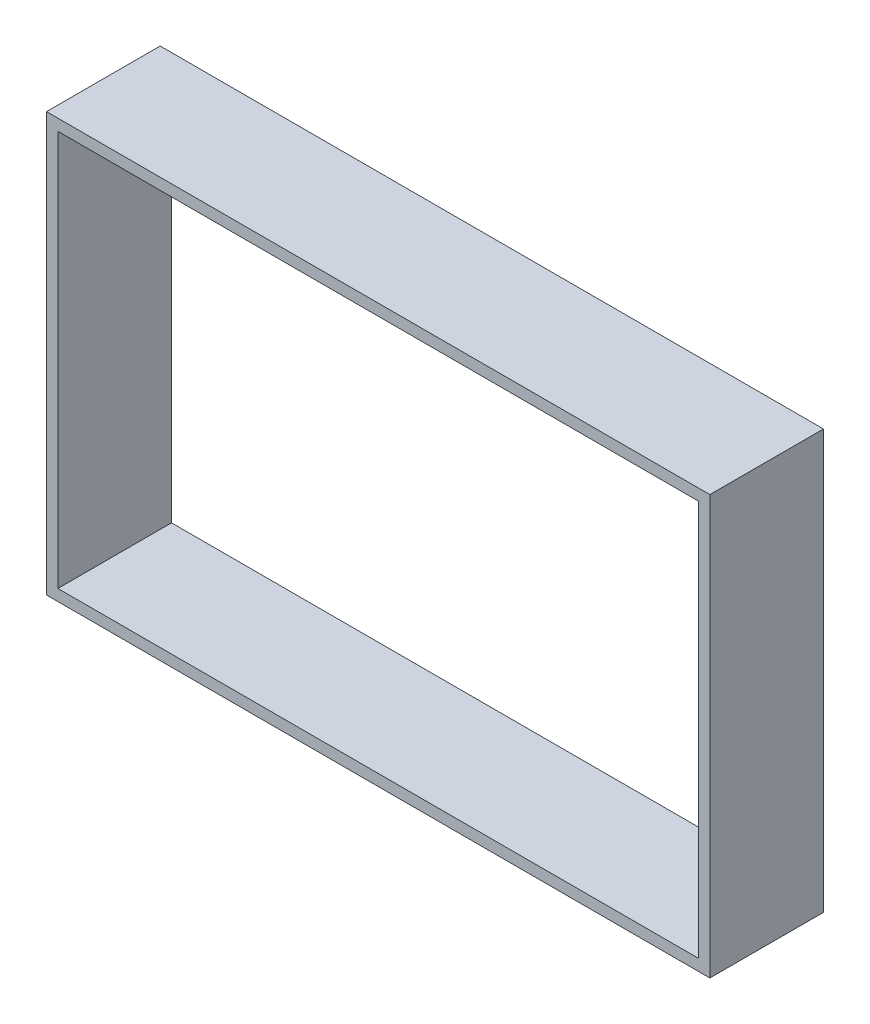
from build123d import *

# Parameters (mm, degrees)
EXTRUDE_START         = -100
EXTRUDE_1_OUTLINE_W   = 579.7
EXTRUDE_1_OUTLINE_H   = 368.4
EXTRUDE_1_OUTLINE_W_2 = 559.7
EXTRUDE_1_OUTLINE_H_2 = 348.4
EXTRUDE_1_DEPTH       = 100
SKETCH_3_W            = 2
SKETCH_3_H            = 368.4
EXTRUDE_2_DEPTH       = 100
SKETCH_4_W            = 2
SKETCH_4_H            = 348.4
CUT_EXTRUDE_3_DEPTH   = 100


# Read off the part's stored shape, not the designer's step: 填料-伸長1
with BuildPart() as part:
    # 填料-伸長1 outline → 填料-伸長1 (new body)
    with BuildSketch(Plane(origin=(0, 0, 2008.045378916), x_dir=(-1, 0, 0), z_dir=(0, 0, -1)).offset(EXTRUDE_START)):
        with Locations((268.443182196, 224.704175019)):
            Rectangle(EXTRUDE_1_OUTLINE_W, EXTRUDE_1_OUTLINE_H)
        with Locations((268.443182196, 224.704175019)):
            Rectangle(EXTRUDE_1_OUTLINE_W_2, EXTRUDE_1_OUTLINE_H_2, mode=Mode.SUBTRACT)
    extrude(amount=EXTRUDE_1_DEPTH)

    # 草圖3 → 填料-伸長2 (add)
    with BuildSketch(Plane(origin=(0, 0, 2008.045378916), x_dir=(-1, 0, 0), z_dir=(0, 0, -1))):
        with Locations((-22.406817804, 224.704175019)):
            Rectangle(SKETCH_3_W, SKETCH_3_H)
        with Locations((559.293182196, 224.704175019)):
            Rectangle(SKETCH_3_W, SKETCH_3_H)
    extrude(amount=-EXTRUDE_2_DEPTH)

    # 草圖4 → 除料-伸長3 (cut)
    with BuildSketch(Plane(origin=(0, 0, 2008.045378916), x_dir=(-1, 0, 0), z_dir=(0, 0, -1))):
        with Locations((-12.406817804, 224.704175019)):
            Rectangle(SKETCH_4_W, SKETCH_4_H)
        with Locations((549.293182196, 224.704175019)):
            Rectangle(SKETCH_4_W, SKETCH_4_H)
    extrude(amount=-CUT_EXTRUDE_3_DEPTH, mode=Mode.SUBTRACT)


solid = part.part
